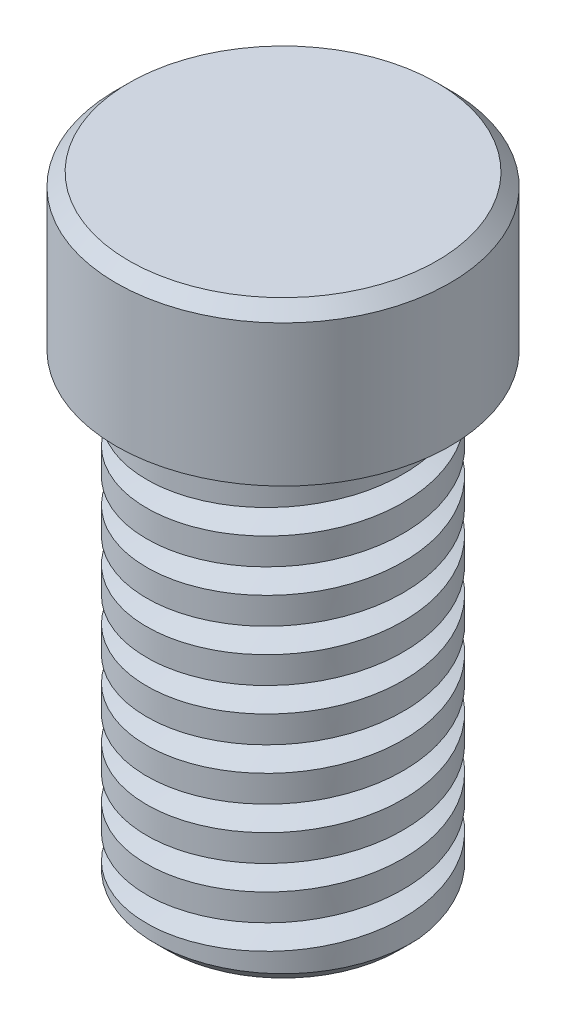
from build123d import *

# Parameters (mm, degrees)
SKETCH_1_R      = 32.5
EXTRUDE_1_DEPTH = 30
CHAMFER_1_SIZE  = 2.5
SKETCH_2_R      = 25
EXTRUDE_2_DEPTH = 90
SWEEP_3_PITCH   = 10
CHAMFER_2_SIZE  = 2.5
SKETCH_6_W      = 41.986146384
SKETCH_6_H      = 5


with BuildPart() as part:
    # 草图1 → 凸台-拉伸1 (new body)
    with BuildSketch(Plane(origin=(0, 0, 0), x_dir=(1, 0, 0), z_dir=(0, 1, 0))):
        with Locations(Location((0, 0, 0), (0, 0, 270))):
            Circle(SKETCH_1_R)
    extrude(amount=EXTRUDE_1_DEPTH)

    # 倒角1
    chamfer_1_edges = [part.edges().sort_by_distance(p)[0] for p in [
        (0, 30, -32.5),
    ]]
    chamfer(chamfer_1_edges, length=CHAMFER_1_SIZE)

    # 草图2 → 凸台-拉伸2 (add)
    with BuildSketch(Plane.XZ):
        with Locations(Location((0, 0, 0), (0, 0, 90))):
            Circle(SKETCH_2_R)
    extrude(amount=EXTRUDE_2_DEPTH)

    # 切除-扫描3: arcs per turn and ends read off the stored shape
    # 切除-扫描3: the profile of 草图5 screwed along a right-hand helix through 8.5 turns, 16 arcs to a turn; built about Z, then put on its axis
    sweep_3_z = Axis((0, 0, 0), (0, 0, 1))
    sweep_3_corners = [(20, 0, 1.062177826), (20, 0, -1.062177826), (27.416911852, 0, -3.049533368), (27.416911852, 0, 3.049533368)]
    with BuildLine(mode=Mode.PRIVATE) as sweep_3_profile:
        Line(sweep_3_corners[0], sweep_3_corners[1])
        Line(sweep_3_corners[1], sweep_3_corners[2])
        Line(sweep_3_corners[2], sweep_3_corners[3])
        Line(sweep_3_corners[3], sweep_3_corners[0])
    sweep_3_cap = Face(sweep_3_profile.wire())
    sweep_3_turn_angles = [0, 11.25, 22.5, 33.75, 45, 56.25, 67.5, 78.75, 90, 101.25, 112.5, 123.75, 135, 146.25, 157.5, 168.75, 180, 191.25, 202.5, 213.75, 225, 236.25, 247.5, 258.75, 270, 281.25, 292.5, 303.75, 315, 326.25, 337.5, 348.75, 360]
    sweep_3_turn_weights = [1, 0.9807852804032304, 1, 0.9807852804032304, 1, 0.9807852804032304, 1, 0.9807852804032304, 1, 0.9807852804032304, 1, 0.9807852804032304, 1, 0.9807852804032304, 1, 0.9807852804032304, 1, 0.9807852804032304, 1, 0.9807852804032304, 1, 0.9807852804032304, 1, 0.9807852804032304, 1, 0.9807852804032304, 1, 0.9807852804032304, 1, 0.9807852804032304, 1, 0.9807852804032304, 1]
    sweep_3_turn_rails = [Edge.make_bspline([Vector(p[0], p[1], 0).rotate(sweep_3_z, sweep_3_turn_angles[k]) / sweep_3_turn_weights[k] + Vector(0, 0, p[2] + SWEEP_3_PITCH * sweep_3_turn_angles[k] / 360) for k in range(33)], [0, 0, 0, 1, 1, 2, 2, 3, 3, 4, 4, 5, 5, 6, 6, 7, 7, 8, 8, 9, 9, 10, 10, 11, 11, 12, 12, 13, 13, 14, 14, 15, 15, 16, 16, 16], 2, sweep_3_turn_weights) for p in sweep_3_corners]
    sweep_3_turn_sides = [Face.make_surface_from_curves(sweep_3_turn_rails[p[0]], sweep_3_turn_rails[p[1]]) for p in [(0, 1), (1, 2), (2, 3), (3, 0)]]
    sweep_3_last_angles = [2880, 2891.25, 2902.5, 2913.75, 2925, 2936.25, 2947.5, 2958.75, 2970, 2981.25, 2992.5, 3003.75, 3015, 3026.25, 3037.5, 3048.75, 3060]
    sweep_3_last_weights = [1, 0.9807852804032304, 1, 0.9807852804032304, 1, 0.9807852804032304, 1, 0.9807852804032304, 1, 0.9807852804032304, 1, 0.9807852804032304, 1, 0.9807852804032304, 1, 0.980785280403201, 1]
    sweep_3_last_rails = [Edge.make_bspline([Vector(p[0], p[1], 0).rotate(sweep_3_z, sweep_3_last_angles[k]) / sweep_3_last_weights[k] + Vector(0, 0, p[2] + SWEEP_3_PITCH * sweep_3_last_angles[k] / 360) for k in range(17)], [0, 0, 0, 1, 1, 2, 2, 3, 3, 4, 4, 5, 5, 6, 6, 7, 7, 8, 8, 8], 2, sweep_3_last_weights) for p in sweep_3_corners]
    sweep_3_last_sides = [Face.make_surface_from_curves(sweep_3_last_rails[p[0]], sweep_3_last_rails[p[1]]) for p in [(0, 1), (1, 2), (2, 3), (3, 0)]]
    sweep_3 = Plane(origin=(0, -90, 0), x_dir=(1, 0, 0), z_dir=(0, 1, 0)) * Solid(Shell([*[p.moved(Location((0, 0, SWEEP_3_PITCH * i))) for i in range(8) for p in sweep_3_turn_sides], *sweep_3_last_sides, sweep_3_cap, sweep_3_cap.rotate(sweep_3_z, 3060).moved(Location((0, 0, SWEEP_3_PITCH * 3060 / 360)))]))
    add(sweep_3, mode=Mode.SUBTRACT)

    # 倒角2
    chamfer_2_edges = [part.edges().sort_by_distance(p)[0] for p in [
        (-24.987955864, -90, -0.775926368),
    ]]
    chamfer(chamfer_2_edges, length=CHAMFER_2_SIZE)

    # 草图6 → 切除-旋转1 (revolve, cut)
    with BuildSketch(Plane.XY, mode=Mode.PRIVATE) as cut_revolve_1_sk:
        with Locations((35.993073192, -2.5)):
            Rectangle(SKETCH_6_W, SKETCH_6_H)
    revolve(cut_revolve_1_sk.sketch.rotate(Axis((0, 33.233441647, 0), (0, -1, 0)), 180), axis=Axis((0, 33.233441647, 0), (0, -1, 0)), mode=Mode.SUBTRACT)


solid = part.part
